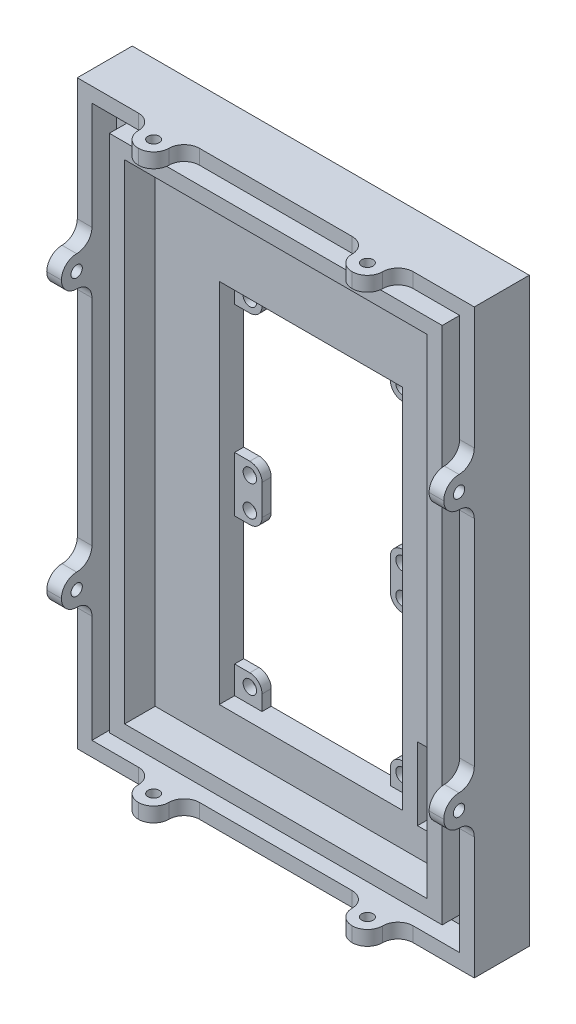
from build123d import *

# Parameters (mm, degrees)
SKETCH1_W               = 130
SKETCH1_H               = 190.3
BOSS_EXTRUDE1_DEPTH     = 3
SKETCH2_W               = 130
SKETCH2_H               = 190.3
SKETCH2_W_2             = 120.4
SKETCH2_H_2             = 180.7
BOSS_EXTRUDE3_DEPTH     = 10
SKETCH5_W               = 109
SKETCH5_H               = 170
BOSS_EXTRUDE5_DEPTH     = 5
CUT_EXTRUDE1_DEPTH      = 231.831302037
CUT_EXTRUDE1_DEPTH_BACK = 231.831302037
SKETCH7_R               = 2.2
BOSS_EXTRUDE6_DEPTH     = 3
BOSS_EXTRUDE7_DEPTH     = 7
SKETCH11_W              = 120.4
SKETCH11_H              = 180.7
SKETCH11_W_2            = 109
SKETCH11_H_2            = 170
BOSS_EXTRUDE8_DEPTH     = 7
SKETCH12_W              = 109
SKETCH12_H              = 170
SKETCH12_W_2            = 99
SKETCH12_H_2            = 160
BOSS_EXTRUDE9_DEPTH     = 10
SKETCH13_W              = 6.040563736
SKETCH13_H              = 3.844156165
CUT_EXTRUDE2_DEPTH      = 7
SKETCH14_W              = 130
SKETCH14_H              = 190.3
SKETCH14_W_2            = 120.4
SKETCH14_H_2            = 180.7
BOSS_EXTRUDE10_DEPTH    = 5
BOSS_EXTRUDE11_REACH    = 233.167
SKETCH16_R              = 1.85
SKETCH16_W              = 10
SKETCH16_H              = 10
SKETCH17_W              = 120.4
SKETCH17_H              = 100.3
CUT_EXTRUDE3_DEPTH      = 10
BOSS_EXTRUDE12_REACH    = 234.16
SKETCH18_W              = 10
SKETCH18_H              = 10
SKETCH18_R              = 1.85
SKETCH19_W              = 80
SKETCH19_H              = 180.7
CUT_EXTRUDE4_DEPTH      = 10
FILLET1_R               = 5
CUT_EXTRUDE5_DEPTH      = 232.33112631
CUT_EXTRUDE5_DEPTH_BACK = 232.33112631
SKETCH20_R              = 1.4
CUT_EXTRUDE6_OUTLINE_W  = 6.153846154
CUT_EXTRUDE6_OUTLINE_H  = 1.73076923
CUT_EXTRUDE6_DEPTH      = 0.5


# Read off the part's stored shape, not the designer's step: Cut-Extrude6
with BuildPart() as part:
    # Sketch1 → Boss-Extrude1 (new body)
    with BuildSketch(Plane.XY):
        with Locations((65, 95.15)):
            Rectangle(SKETCH1_W, SKETCH1_H)
    extrude(amount=BOSS_EXTRUDE1_DEPTH)

    # Sketch2 → Boss-Extrude3 (add)
    with BuildSketch(Plane.XY.offset(3)):
        with Locations((65, 95.15)):
            Rectangle(SKETCH2_W, SKETCH2_H)
        with Locations((65, 95.15)):
            Rectangle(SKETCH2_W_2, SKETCH2_H_2, mode=Mode.SUBTRACT)
    extrude(amount=BOSS_EXTRUDE3_DEPTH)

    # Sketch5 → Boss-Extrude5 (add)
    with BuildSketch(Plane.XY.offset(3)):
        with Locations((65, 94.8)):
            Rectangle(SKETCH5_W, SKETCH5_H)
    extrude(amount=BOSS_EXTRUDE5_DEPTH)

    # Sketch6 → Cut-Extrude1 (cut, two sides: drawn at the far end of the back side and taken through both)
    with BuildSketch(Plane(origin=(0, 0, 0), x_dir=(-1, 0, 0), z_dir=(0, 0, -1)).offset(-CUT_EXTRUDE1_DEPTH_BACK)):
        Polygon((-66.5, 25.8), (-36.5, 25.8), (-36.5, 85.8), (-36.5, 145.8), (-96.5, 145.8), (-96.5, 85.8), (-96.5, 25.8), align=None)
    extrude(amount=CUT_EXTRUDE1_DEPTH + CUT_EXTRUDE1_DEPTH_BACK, mode=Mode.SUBTRACT)

    # Sketch7 → Boss-Extrude6 (add)
    # profile 1 of 6: a face of its own
    with BuildSketch(Plane(origin=(0, 0, 0), x_dir=(-1, 0, 0), z_dir=(0, 0, -1))):
        with BuildLine():
            Line((-91.5, 136.8), (-96.5, 136.8))
            Line((-96.5, 136.8), (-96.5, 145.8))
            Line((-96.5, 145.8), (-87.5, 145.8))
            Line((-87.5, 145.8), (-87.5, 140.8))
            ThreePointArc((-87.5, 140.8), (-88.671572875, 137.971572875), (-91.5, 136.8))
        make_face()
        with Locations((-91.5, 140.8)):
            Circle(SKETCH7_R, mode=Mode.SUBTRACT)
    # profile 2 of 6: a face of its own
    with BuildSketch(Plane(origin=(0, 0, 0), x_dir=(-1, 0, 0), z_dir=(0, 0, -1))):
        with BuildLine():
            Line((-36.5, 145.8), (-36.5, 136.8))
            Line((-36.5, 136.8), (-41.5, 136.8))
            ThreePointArc((-41.5, 136.8), (-44.328427125, 137.971572875), (-45.5, 140.8))
            Line((-45.5, 140.8), (-45.5, 145.8))
            Line((-45.5, 145.8), (-36.5, 145.8))
        make_face()
        with Locations(Location((-41.5, 140.8, 0), (0, 0, 180))):
            Circle(SKETCH7_R, mode=Mode.SUBTRACT)
    # profile 3 of 6: a face of its own
    with BuildSketch(Plane(origin=(0, 0, 0), x_dir=(-1, 0, 0), z_dir=(0, 0, -1))):
        with BuildLine():
            Line((-45.5, 90.8), (-45.5, 80.8))
            ThreePointArc((-45.5, 80.8), (-44.328427125, 77.971572875), (-41.5, 76.8))
            Line((-41.5, 76.8), (-36.5, 76.8))
            Line((-36.5, 76.8), (-36.5, 94.8))
            Line((-36.5, 94.8), (-41.5, 94.8))
            ThreePointArc((-41.5, 94.8), (-44.328427125, 93.628427125), (-45.5, 90.8))
        make_face()
        with Locations((-41.5, 90.8)):
            Circle(SKETCH7_R, mode=Mode.SUBTRACT)
        with Locations(Location((-41.5, 80.8, 0), (0, 0, 180))):
            Circle(SKETCH7_R, mode=Mode.SUBTRACT)
    # profile 4 of 6: a face of its own
    with BuildSketch(Plane(origin=(0, 0, 0), x_dir=(-1, 0, 0), z_dir=(0, 0, -1))):
        with BuildLine():
            Line((-96.5, 76.8), (-96.5, 94.8))
            Line((-96.5, 94.8), (-91.5, 94.8))
            ThreePointArc((-91.5, 94.8), (-88.671572875, 93.628427125), (-87.5, 90.8))
            Line((-87.5, 90.8), (-87.5, 80.8))
            ThreePointArc((-87.5, 80.8), (-88.671572875, 77.971572875), (-91.5, 76.8))
            Line((-91.5, 76.8), (-96.5, 76.8))
        make_face()
        with Locations(Location((-91.5, 90.8, 0), (0, 0, 180))):
            Circle(SKETCH7_R, mode=Mode.SUBTRACT)
        with Locations((-91.5, 80.8)):
            Circle(SKETCH7_R, mode=Mode.SUBTRACT)
    # profile 5 of 6: a face of its own
    with BuildSketch(Plane(origin=(0, 0, 0), x_dir=(-1, 0, 0), z_dir=(0, 0, -1))):
        with BuildLine():
            Line((-45.5, 30.8), (-45.5, 25.8))
            Line((-45.5, 25.8), (-36.5, 25.8))
            Line((-36.5, 25.8), (-36.5, 34.8))
            Line((-36.5, 34.8), (-41.5, 34.8))
            ThreePointArc((-41.5, 34.8), (-44.328427125, 33.628427125), (-45.5, 30.8))
        make_face()
        with Locations((-41.5, 30.8)):
            Circle(SKETCH7_R, mode=Mode.SUBTRACT)
    # profile 6 of 6: a face of its own
    with BuildSketch(Plane(origin=(0, 0, 0), x_dir=(-1, 0, 0), z_dir=(0, 0, -1))):
        with BuildLine():
            Line((-96.5, 25.8), (-96.5, 34.8))
            Line((-96.5, 34.8), (-91.5, 34.8))
            ThreePointArc((-91.5, 34.8), (-88.671572875, 33.628427125), (-87.5, 30.8))
            Line((-87.5, 30.8), (-87.5, 25.8))
            Line((-87.5, 25.8), (-96.5, 25.8))
        make_face()
        with Locations(Location((-91.5, 30.8, 0), (0, 0, 180))):
            Circle(SKETCH7_R, mode=Mode.SUBTRACT)
    extrude(amount=-BOSS_EXTRUDE6_DEPTH)

    # Sketch10 → Boss-Extrude7 (add)
    with BuildSketch(Plane.XY.offset(3)):
        Polygon((96.5, 145.8), (92.700427806, 145.8), (91.96048299, 143.855861896), (96.5, 143.855861896), align=None)
    extrude(amount=BOSS_EXTRUDE7_DEPTH)

    # Sketch11 → Boss-Extrude8 (add)
    with BuildSketch(Plane.XY.offset(3)):
        with Locations((65, 95.15)):
            Rectangle(SKETCH11_W, SKETCH11_H)
        with Locations((65, 94.8)):
            Rectangle(SKETCH11_W_2, SKETCH11_H_2, mode=Mode.SUBTRACT)
    extrude(amount=BOSS_EXTRUDE8_DEPTH)

    # Sketch12 → Boss-Extrude9 (add)
    with BuildSketch(Plane.XY.offset(8)):
        with Locations((65, 94.8)):
            Rectangle(SKETCH12_W, SKETCH12_H)
        with Locations((65, 94.8)):
            Rectangle(SKETCH12_W_2, SKETCH12_H_2, mode=Mode.SUBTRACT)
    extrude(amount=BOSS_EXTRUDE9_DEPTH)

    # Sketch13 → Cut-Extrude2 (cut)
    with BuildSketch(Plane.XY.offset(10)):
        with Locations((93.479718132, 143.877921918)):
            Rectangle(SKETCH13_W, SKETCH13_H)
    extrude(amount=-CUT_EXTRUDE2_DEPTH, mode=Mode.SUBTRACT)

    # Sketch14 → Boss-Extrude10 (add)
    with BuildSketch(Plane.XY.offset(13)):
        with Locations((65, 95.15)):
            Rectangle(SKETCH14_W, SKETCH14_H)
        with Locations((65, 95.15)):
            Rectangle(SKETCH14_W_2, SKETCH14_H_2, mode=Mode.SUBTRACT)
    extrude(amount=BOSS_EXTRUDE10_DEPTH)

    # Boss-Extrude11: up to this face of the body (flat: up to its plane)
    boss_extrude11_end = Plane(part.part.faces().sort_by_distance((130, 95.15, 9))[0])
    # Sketch16 → Boss-Extrude11 (add, up to the picked face)
    with BuildSketch(Plane.ZY, mode=Mode.PRIVATE) as boss_extrude11_sk1:
        Polygon((28, 45), (18, 45), (18, 55), (28, 55), (28, 50), align=None)
        with Locations((23, 50)):
            Circle(SKETCH16_R, mode=Mode.SUBTRACT)
    boss_extrude11_tool1 = split(extrude(boss_extrude11_sk1.sketch, amount=-BOSS_EXTRUDE11_REACH, mode=Mode.PRIVATE), bisect_by=boss_extrude11_end, keep=Keep.BOTH, mode=Mode.PRIVATE)
    # Sketch16 → Boss-Extrude11 (add, up to the picked face)
    with BuildSketch(Plane.ZY, mode=Mode.PRIVATE) as boss_extrude11_sk2:
        with Locations((23, 140.3)):
            Rectangle(SKETCH16_W, SKETCH16_H)
        with Locations((23, 140.3)):
            Circle(SKETCH16_R, mode=Mode.SUBTRACT)
    boss_extrude11_tool2 = split(extrude(boss_extrude11_sk2.sketch, amount=-BOSS_EXTRUDE11_REACH, mode=Mode.PRIVATE), bisect_by=boss_extrude11_end, keep=Keep.BOTH, mode=Mode.PRIVATE)
    add(boss_extrude11_tool1.solids().sort_by(Axis((0, 45.141421, 23), (1, 0, 0)))[0])
    add(boss_extrude11_tool2.solids().sort_by(Axis((0, 145.158579, 23), (1, 0, 0)))[0])

    # Sketch17 → Cut-Extrude3 (cut)
    with BuildSketch(Plane.XY.offset(28)):
        with Locations((65, 95.15)):
            Rectangle(SKETCH17_W, SKETCH17_H)
    extrude(amount=-CUT_EXTRUDE3_DEPTH, mode=Mode.SUBTRACT)

    # Boss-Extrude12: up to this face of the body (flat: up to its plane)
    boss_extrude12_end = Plane(part.part.faces().sort_by_distance((65, 190.3, 9))[0])
    # Sketch18 → Boss-Extrude12 (add, up to the picked face)
    with BuildSketch(Plane.XZ, mode=Mode.PRIVATE) as boss_extrude12_sk1:
        with Locations((100, 23)):
            Rectangle(SKETCH18_W, SKETCH18_H)
        with Locations(Location((100, 23, 0), (0, 0, 270))):
            Circle(SKETCH18_R, mode=Mode.SUBTRACT)
    boss_extrude12_tool1 = split(extrude(boss_extrude12_sk1.sketch, amount=-BOSS_EXTRUDE12_REACH, mode=Mode.PRIVATE), bisect_by=boss_extrude12_end, keep=Keep.BOTH, mode=Mode.PRIVATE)
    # Sketch18 → Boss-Extrude12 (add, up to the picked face)
    with BuildSketch(Plane.XZ, mode=Mode.PRIVATE) as boss_extrude12_sk2:
        with Locations((30, 23)):
            Rectangle(SKETCH18_W, SKETCH18_H)
        with Locations(Location((30, 23, 0), (0, 0, 270))):
            Circle(SKETCH18_R, mode=Mode.SUBTRACT)
    boss_extrude12_tool2 = split(extrude(boss_extrude12_sk2.sketch, amount=-BOSS_EXTRUDE12_REACH, mode=Mode.PRIVATE), bisect_by=boss_extrude12_end, keep=Keep.BOTH, mode=Mode.PRIVATE)
    add(boss_extrude12_tool1.solids().sort_by(Axis((100, 0, 18.141421), (0, 1, 0)))[0])
    add(boss_extrude12_tool2.solids().sort_by(Axis((34.858579, 0, 23), (0, 1, 0)))[0])

    # Sketch19 → Cut-Extrude4 (cut)
    with BuildSketch(Plane.XY.offset(28)):
        with Locations((65, 95.15)):
            Rectangle(SKETCH19_W, SKETCH19_H)
    extrude(amount=-CUT_EXTRUDE4_DEPTH, mode=Mode.SUBTRACT)

    # Fillet1
    fillet1_edges = [part.edges().sort_by_distance(p)[0] for p in [
        (2.4, 45, 18),
        (35, 2.4, 18),
        (105, 2.4, 18),
        (105, 187.9, 18),
        (35, 187.9, 18),
        (127.6, 135.3, 18),
        (127.6, 145.3, 18),
        (127.6, 55, 18),
        (127.6, 45, 18),
        (25, 2.4, 18),
        (95, 2.4, 18),
        (2.4, 135.3, 18),
        (2.4, 55, 18),
        (2.4, 145.3, 18),
        (95, 187.9, 18),
        (25, 187.9, 18),
    ]]
    fillet(fillet1_edges, radius=FILLET1_R)
    fillet1_2_edges = [part.edges().sort_by_distance(p)[0] for p in [
        (105, 187.9, 28),
        (95, 187.9, 28),
        (35, 187.9, 28),
        (25, 187.9, 28),
        (2.4, 145.3, 28),
        (2.4, 135.3, 28),
        (2.4, 55, 28),
        (2.4, 45, 28),
        (25, 2.4, 28),
        (35, 2.4, 28),
        (95, 2.4, 28),
        (105, 2.4, 28),
        (127.6, 45, 28),
        (127.6, 55, 28),
        (127.6, 135.3, 28),
        (127.6, 145.3, 28),
    ]]
    fillet(fillet1_2_edges, radius=FILLET1_R - 0.0001)  # a hair under: the kernel refuses the full size

    # Sketch20 → Cut-Extrude5 (cut, two sides: drawn at the far end of the back side and taken through both)
    with BuildSketch(Plane.XY.offset(8).offset(-CUT_EXTRUDE5_DEPTH_BACK)):
        with Locations((106.95, 51.5)):
            Circle(SKETCH20_R)
        with Locations((106.95, 19.1)):
            Circle(SKETCH20_R)
        Polygon((101.4, 35.8), (101.4, 47.7), (112.5, 47.7), (112.5, 23.9), (101.4, 23.9), align=None)
    extrude(amount=CUT_EXTRUDE5_DEPTH + CUT_EXTRUDE5_DEPTH_BACK, mode=Mode.SUBTRACT)

    # Cut-Extrude6 outline → Cut-Extrude6 (cut)
    # profile 1 of 8: a face of its own
    with BuildSketch(Plane.XY):
        with BuildLine():
            add(Edge.make_bspline(
                [(93.492136119, 6.985668144), (93.493441247, 6.880957542), (93.495982761, 6.677051461), (93.509092865, 6.378987522), (93.535229307, 6.097092642), (93.567410084, 5.830575614), (93.612548787, 5.580245866), (93.667510336, 5.345971151), (93.729145269, 5.12651972), (93.804490991, 4.92381488), (93.887920541, 4.734444989), (93.978435976, 4.556544005), (94.078124211, 4.38976135), (94.188504591, 4.235906593), (94.304317417, 4.09013855), (94.430594016, 3.957523464), (94.565033042, 3.835533607), (94.707309334, 3.725722564), (94.855794397, 3.62669506), (95.011419707, 3.54310388), (95.170262309, 3.468908384), (95.335868738, 3.412679165), (95.504881983, 3.36469214), (95.680147976, 3.333695084), (95.860039737, 3.313172388), (95.981527963, 3.310389422), (96.042817208, 3.308985452)],
                knots=[0, 0, 0, 0, 0.062358645, 0.121432852, 0.177603569, 0.23090887, 0.281248083, 0.328981984, 0.374173859, 0.41688378, 0.457636953, 0.497347357, 0.53567886, 0.573212798, 0.610031937, 0.64645653, 0.682124568, 0.718035057, 0.753392217, 0.788268424, 0.823144631, 0.857652358, 0.892293413, 0.927670287, 0.963510591, 1, 1, 1, 1], degree=3))
            add(Edge.make_bspline(
                [(96.042817208, 3.308985452), (96.099422812, 3.309947291), (96.211534247, 3.311852283), (96.377084772, 3.330535776), (96.538354737, 3.361543845), (96.694870488, 3.405002975), (96.84773173, 3.460179372), (96.996275559, 3.527017862), (97.139525638, 3.607951102), (97.278849041, 3.698886404), (97.412222316, 3.802318623), (97.53645032, 3.91922292), (97.654519901, 4.04680545), (97.764092019, 4.186442026), (97.867588066, 4.337231237), (97.960888213, 4.500593711), (98.047874224, 4.674784681), (98.128521179, 4.86114584), (98.201337777, 5.062915117), (98.259415572, 5.28403995), (98.314182368, 5.522107452), (98.354373312, 5.779525994), (98.389244151, 6.054353561), (98.409474718, 6.348374219), (98.426763295, 6.660612837), (98.427602372, 6.875329833), (98.428033555, 6.985668144)],
                knots=[0, 0, 0, 0, 0.034422531, 0.068176277, 0.101187772, 0.134229865, 0.166878146, 0.199963028, 0.23318568, 0.266859096, 0.301097951, 0.335699678, 0.370509884, 0.406744748, 0.443573783, 0.481662118, 0.521080332, 0.561961379, 0.605128762, 0.651412327, 0.700940997, 0.753667628, 0.809812231, 0.869410748, 0.932893074, 1, 1, 1, 1], degree=3))
            add(Edge.make_bspline(
                [(98.428033555, 6.985668144), (98.427365439, 7.096926573), (98.426067933, 7.312994785), (98.412086732, 7.627318692), (98.387968126, 7.92235887), (98.356988624, 8.198124073), (98.314129306, 8.454803768), (98.265089367, 8.692524796), (98.204722704, 8.911316403), (98.134212374, 9.111569002), (98.055043453, 9.296839146), (97.967996848, 9.469447517), (97.873623868, 9.631585603), (97.7725619, 9.783196933), (97.660033038, 9.920903819), (97.54264349, 10.049422326), (97.415985555, 10.16624367), (97.28121994, 10.270782996), (97.141812159, 10.365296543), (96.996113815, 10.44495886), (96.847500801, 10.514352329), (96.694077967, 10.570485622), (96.5369577, 10.61409049), (96.3755773, 10.644542198), (96.210704149, 10.665512544), (96.09897269, 10.667141239), (96.042817208, 10.667959811)],
                knots=[0, 0, 0, 0, 0.067605355, 0.131292239, 0.191134408, 0.247469081, 0.299860761, 0.349217261, 0.394905185, 0.437665207, 0.478130768, 0.517254264, 0.555057411, 0.59208323, 0.6278365, 0.663011965, 0.697786071, 0.732388072, 0.766577265, 0.800013697, 0.833182444, 0.866160928, 0.899168755, 0.932146017, 0.965897044, 1, 1, 1, 1], degree=3))
            add(Edge.make_bspline(
                [(96.042817208, 10.667959811), (95.981557711, 10.666346605), (95.860642345, 10.663162425), (95.681198109, 10.645833922), (95.50777022, 10.610824579), (95.337979166, 10.566921501), (95.174575137, 10.506905042), (95.014321303, 10.437888866), (94.862150185, 10.350473419), (94.712871535, 10.254852794), (94.571603677, 10.14458333), (94.436486576, 10.024767838), (94.311732877, 9.891316403), (94.192795079, 9.748821057), (94.085774007, 9.591701102), (93.983893053, 9.425458203), (93.893683973, 9.245952126), (93.808095239, 9.056358329), (93.734526632, 8.851635516), (93.667940007, 8.6329528), (93.613978833, 8.397585651), (93.569216225, 8.146265541), (93.534720284, 7.878569351), (93.509244149, 7.595132964), (93.495943156, 7.29569139), (93.493427708, 7.090847778), (93.492136119, 6.985668144)],
                knots=[0, 0, 0, 0, 0.036460725, 0.071966994, 0.10709435, 0.141635469, 0.176209045, 0.210576169, 0.245316026, 0.280492894, 0.315985, 0.351831673, 0.387834452, 0.424584678, 0.462157111, 0.5008403, 0.540519488, 0.581607489, 0.62454495, 0.669858622, 0.717555001, 0.768128401, 0.821703128, 0.87810671, 0.937412295, 1, 1, 1, 1], degree=3))
        make_face()
        with BuildLine():
            add(Edge.make_bspline(
                [(94.389572016, 6.988472631), (94.389789561, 7.071224736), (94.390213809, 7.232605196), (94.402822911, 7.468665324), (94.418072278, 7.693363064), (94.444380258, 7.905960495), (94.473823011, 8.107518584), (94.514208126, 8.296612316), (94.557523481, 8.475129427), (94.611636975, 8.640865063), (94.670799167, 8.795490994), (94.733198288, 8.939521911), (94.80066721, 9.073073061), (94.875002015, 9.194468722), (94.953459418, 9.305711401), (95.036332134, 9.406132076), (95.124855035, 9.495165502), (95.24861306, 9.595552592), (95.408152689, 9.700033779), (95.607643672, 9.793800138), (95.813638079, 9.84907823), (95.95276387, 9.856557213), (96.021783555, 9.860267503)],
                knots=[0, 0, 0, 0, 0.067660079, 0.131948481, 0.193277995, 0.251783822, 0.307086638, 0.359786702, 0.409847937, 0.45723286, 0.502239417, 0.545203144, 0.585546693, 0.624486011, 0.661499794, 0.696785781, 0.730841265, 0.763974749, 0.826949787, 0.886296147, 0.943592025, 1, 1, 1, 1], degree=3))
            add(Edge.make_bspline(
                [(96.021783555, 9.860267503), (96.084314066, 9.857090253), (96.211036124, 9.850651355), (96.398536751, 9.794815166), (96.583684151, 9.708356065), (96.732366271, 9.609366109), (96.848223045, 9.514849919), (96.931234787, 9.43157901), (97.007927199, 9.338290873), (97.081938034, 9.236762447), (97.149518158, 9.124477716), (97.215156344, 9.003484976), (97.272988159, 8.871785214), (97.327375631, 8.729845021), (97.375277802, 8.57389943), (97.416703194, 8.401014029), (97.45372179, 8.210302372), (97.480400969, 8.000818841), (97.502828395, 7.773562351), (97.519612908, 7.5280789), (97.529413022, 7.264329082), (97.530194161, 7.082431582), (97.530597657, 6.988472631)],
                knots=[0, 0, 0, 0, 0.051988915, 0.105358841, 0.161616881, 0.221760335, 0.253562677, 0.286046382, 0.319493303, 0.35406988, 0.390592722, 0.428562186, 0.468644379, 0.510291739, 0.555115139, 0.604404338, 0.658309736, 0.716837559, 0.780213072, 0.848502777, 0.921744278, 1, 1, 1, 1], degree=3))
            add(Edge.make_bspline(
                [(97.530597657, 6.988472631), (97.530237195, 6.894511268), (97.529539367, 6.7126091), (97.519177721, 6.449388679), (97.504425535, 6.20428936), (97.482358642, 5.977377594), (97.452933159, 5.768315978), (97.418105184, 5.577393225), (97.378396065, 5.404243558), (97.329983979, 5.248582455), (97.27637923, 5.106750921), (97.216777648, 4.976177154), (97.154891276, 4.853902977), (97.085178165, 4.742351953), (97.011350258, 4.639999659), (96.932074434, 4.547235695), (96.850180724, 4.462026714), (96.733357814, 4.36741018), (96.583672652, 4.268488694), (96.397856334, 4.182709735), (96.210639833, 4.126087154), (96.084332103, 4.119794119), (96.021783555, 4.116677759)],
                knots=[0, 0, 0, 0, 0.078230083, 0.151447587, 0.219300984, 0.282655732, 0.341217425, 0.39503344, 0.444215724, 0.489024438, 0.530658152, 0.570372201, 0.608492482, 0.644672049, 0.679780775, 0.713467215, 0.746216629, 0.778008552, 0.83845766, 0.895050316, 0.948028119, 1, 1, 1, 1], degree=3))
            add(Edge.make_bspline(
                [(96.021783555, 4.116677759), (95.950903458, 4.120386452), (95.80958436, 4.127780757), (95.601455322, 4.181620651), (95.401893841, 4.271983328), (95.243770439, 4.374072726), (95.124301824, 4.473367129), (95.03802383, 4.5578964), (94.958500375, 4.652267501), (94.883427639, 4.755043386), (94.815546787, 4.867905326), (94.750094024, 4.988291777), (94.693104936, 5.119090999), (94.660168269, 5.210237791), (94.643378106, 5.256701798)],
                knots=[0, 0, 0, 0, 0.110990606, 0.221290505, 0.334387201, 0.453015319, 0.514900297, 0.577560375, 0.641980281, 0.708044236, 0.776746608, 0.848170193, 0.922601541, 1, 1, 1, 1], degree=3))
            add(Edge.make_bspline(
                [(94.643378106, 5.256701798), (94.623149832, 5.317748907), (94.581913094, 5.44219767), (94.53024913, 5.635956143), (94.487477728, 5.839267019), (94.450649167, 6.051047555), (94.422685186, 6.272364692), (94.4033562, 6.503005255), (94.392268816, 6.742970662), (94.390480942, 6.905728999), (94.389572016, 6.988472631)],
                knots=[0, 0, 0, 0, 0.109702155, 0.223635444, 0.341877052, 0.464062228, 0.590271834, 0.722321972, 0.858833108, 1, 1, 1, 1], degree=3))
        make_face(mode=Mode.SUBTRACT)
    # profile 2 of 8: a face of its own
    with BuildSketch(Plane.XY):
        with BuildLine():
            add(Edge.make_bspline(
                [(114.851110478, 8.53094058), (114.851895676, 8.575434694), (114.85344935, 8.66347531), (114.874631137, 8.792400235), (114.904469488, 8.917450239), (114.950618981, 9.036614893), (115.006220629, 9.152238633), (115.075768398, 9.262826771), (115.159282902, 9.36735348), (115.252184928, 9.468170548), (115.354937011, 9.559196941), (115.463467766, 9.640834301), (115.57911186, 9.707134458), (115.698707408, 9.765115106), (115.82597211, 9.806219592), (115.957777648, 9.836823994), (116.095158959, 9.858024282), (116.188769177, 9.859509683), (116.236527144, 9.860267503)],
                knots=[0, 0, 0, 0, 0.062464558, 0.123598779, 0.183188668, 0.242854553, 0.302791066, 0.363304439, 0.425993138, 0.490604074, 0.555743866, 0.618679914, 0.681099547, 0.742813418, 0.80513618, 0.868557225, 0.932940657, 1, 1, 1, 1], degree=3))
            add(Edge.make_bspline(
                [(116.236527144, 9.860267503), (116.281930403, 9.859336273), (116.371250533, 9.8575043), (116.502796533, 9.838602581), (116.629064406, 9.807826866), (116.75048011, 9.765138141), (116.867923036, 9.712472611), (116.97852151, 9.64424452), (117.084083228, 9.564874228), (117.186003742, 9.475793023), (117.278763164, 9.371283034), (117.361729577, 9.252582728), (117.434992195, 9.119562766), (117.497613736, 8.97245585), (117.549511267, 8.810876043), (117.59114328, 8.635019821), (117.623328851, 8.444810651), (117.636306766, 8.31275831), (117.642977465, 8.244882888)],
                knots=[0, 0, 0, 0, 0.056971305, 0.112077514, 0.166447641, 0.219897906, 0.273467232, 0.327713707, 0.382641522, 0.439172888, 0.497361289, 0.557599766, 0.620640084, 0.687678037, 0.758012521, 0.833449836, 0.914392561, 1, 1, 1, 1], degree=3))
            Line((117.642977465, 8.244882888), (118.530597657, 8.244882888))
            add(Edge.make_bspline(
                [(118.530597657, 8.244882888), (118.526428238, 8.335203015), (118.518273426, 8.511856793), (118.482061857, 8.769261083), (118.423401694, 9.011801586), (118.349360186, 9.241534397), (118.250590877, 9.455587734), (118.136630852, 9.657693095), (117.999054918, 9.843614749), (117.843586596, 10.013646809), (117.674820242, 10.168127553), (117.493395622, 10.301333364), (117.302379369, 10.414844384), (117.101733922, 10.507470128), (116.891066339, 10.579188474), (116.670977102, 10.631376116), (116.440764101, 10.662765743), (116.283833732, 10.666212451), (116.204275542, 10.667959811)],
                knots=[0, 0, 0, 0, 0.072185261, 0.141184467, 0.207190342, 0.271289739, 0.333603347, 0.395138342, 0.45628715, 0.517858368, 0.578902257, 0.638706566, 0.697285504, 0.756078148, 0.814867237, 0.874716965, 0.936485898, 1, 1, 1, 1], degree=3))
            add(Edge.make_bspline(
                [(116.204275542, 10.667959811), (116.120977946, 10.666255903), (115.957525028, 10.662912364), (115.719498213, 10.631449257), (115.49422762, 10.580715019), (115.28164729, 10.51143029), (115.08214453, 10.418917131), (114.895325933, 10.307356465), (114.72298729, 10.173264573), (114.563877778, 10.023224118), (114.423342937, 9.858178382), (114.296411111, 9.688491759), (114.191489668, 9.510722813), (114.103591947, 9.328117643), (114.035953265, 9.139177534), (113.988187039, 8.944671387), (113.959555165, 8.744467035), (113.955647219, 8.609090939), (113.95367458, 8.540756285)],
                knots=[0, 0, 0, 0, 0.072295147, 0.141863069, 0.208024754, 0.272578644, 0.335589613, 0.398578359, 0.461082806, 0.524813715, 0.588114162, 0.6490738, 0.708582835, 0.767034896, 0.824801029, 0.882481561, 0.94067947, 1, 1, 1, 1], degree=3))
            add(Edge.make_bspline(
                [(113.95367458, 8.540756285), (113.957264186, 8.445167318), (113.964394224, 8.255298876), (114.019297721, 7.974399413), (114.111596932, 7.702547387), (114.218211351, 7.481188538), (114.326038974, 7.302261026), (114.424991645, 7.154572433), (114.541235432, 6.994876232), (114.677263242, 6.82424144), (114.827666056, 6.638763866), (114.998418466, 6.443228258), (115.184235425, 6.233675858), (115.31675719, 6.092572961), (115.385365285, 6.019522311)],
                knots=[0, 0, 0, 0, 0.096312923, 0.191306437, 0.28726027, 0.385041783, 0.438291931, 0.49775045, 0.564191602, 0.637336306, 0.717694708, 0.804880875, 0.898984505, 1, 1, 1, 1], degree=3))
            Line((115.385365285, 6.019522311), (117.107320414, 4.296164939))
            Line((117.107320414, 4.296164939), (113.86393099, 4.296164939))
            Line((113.86393099, 4.296164939), (113.86393099, 3.488472631))
            Line((113.86393099, 3.488472631), (118.799828426, 3.488472631))
            Line((118.799828426, 3.488472631), (116.12154317, 6.445804362))
            add(Edge.make_bspline(
                [(116.12154317, 6.445804362), (116.057749966, 6.5138391), (115.93532964, 6.644399005), (115.762795524, 6.835517743), (115.607131125, 7.012204033), (115.467506538, 7.174330326), (115.34757796, 7.324075773), (115.244119074, 7.459237356), (115.158301055, 7.580453334), (115.069178633, 7.72313463), (114.980867454, 7.894170706), (114.905742732, 8.102810701), (114.860664218, 8.315877395), (114.854296616, 8.459217772), (114.851110478, 8.53094058)],
                knots=[0, 0, 0, 0, 0.111796704, 0.214539918, 0.308625582, 0.394072981, 0.47098958, 0.538563461, 0.598097997, 0.648937473, 0.740149715, 0.828231222, 0.914052556, 1, 1, 1, 1], degree=3))
        make_face()
    # profile 3 of 8: a face of its own
    with BuildSketch(Plane.XY):
        Polygon((92.95367458, 3.488472631), (89.689251503, 10.488472631), (89.408802785, 10.488472631), (86.13316176, 3.488472631), (87.054435798, 3.488472631), (88.117336439, 5.732062375), (90.980717849, 5.732062375), (92.04361849, 3.488472631), align=None)
        Polygon((90.638570414, 6.539754682), (88.448265926, 6.539754682), (89.549027144, 8.958624875), align=None, mode=Mode.SUBTRACT)
    # profile 4 of 8: a face of its own
    with BuildSketch(Plane.XY):
        Polygon((102.825469452, 9.680780323), (102.373947016, 10.488472631), (100.851110478, 10.488472631), (100.851110478, 3.488472631), (101.748546375, 3.488472631), (101.748546375, 9.680780323), align=None)
    # profile 5 of 8: a face of its own
    with BuildSketch(Plane.XY):
        Polygon((123.197264324, 9.680780323), (122.745741888, 10.488472631), (121.222905349, 10.488472631), (121.222905349, 3.488472631), (122.120341247, 3.488472631), (122.120341247, 9.680780323), align=None)
    # profile 6 of 8: a face of its own
    with BuildSketch(Plane.XY):
        Polygon((110.188650542, 5.119281926), (107.956278747, 10.488472631), (107.04341817, 10.488472631), (110.045621696, 3.488472631), (110.333081632, 3.488472631), (113.325469452, 10.488472631), (112.42242458, 10.488472631), align=None)
    # profile 7 of 8: a face of its own
    with BuildSketch(Plane.XY):
        with Locations((120.14963328, 29.573076923)):
            Rectangle(CUT_EXTRUDE6_OUTLINE_W, CUT_EXTRUDE6_OUTLINE_H)
    # profile 8 of 8: a face of its own
    with BuildSketch(Plane.XY):
        Polygon((123.774187401, 41.268600364), (123.774187401, 42.422446518), (120.825469452, 42.422446518), (120.825469452, 45.371164466), (119.54341817, 45.371164466), (119.54341817, 42.422446518), (116.594700221, 42.422446518), (116.594700221, 41.268600364), (119.54341817, 41.268600364), (119.54341817, 38.319882415), (120.825469452, 38.319882415), (120.825469452, 41.268600364), align=None)
    extrude(amount=CUT_EXTRUDE6_DEPTH, mode=Mode.SUBTRACT)


solid = part.part
